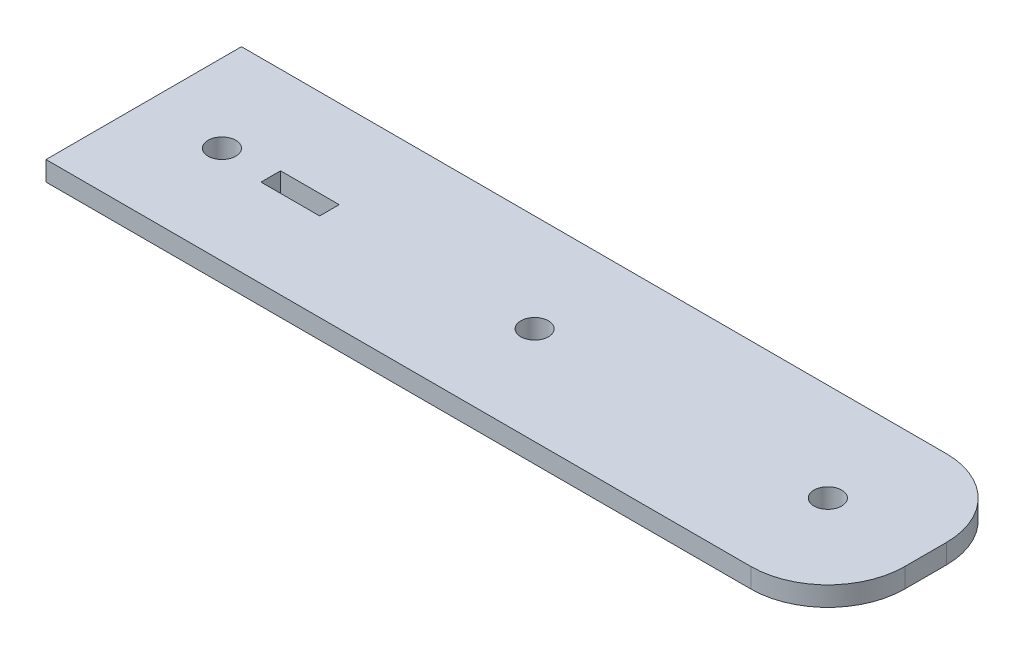
from build123d import *

# Parameters (mm, degrees)
SKETCH1_R           = 2.25
SKETCH1_W           = 9.525
SKETCH1_H           = 3.175
BOSS_EXTRUDE1_DEPTH = 3.175


with BuildPart() as part:
    # Sketch1 → Boss-Extrude1 (new body)
    with BuildSketch(Plane(origin=(0, 0, 0), x_dir=(1, 0, 0), z_dir=(0, 1, 0))):
        with BuildLine():
            Line((-12.7, -15.875), (101.8, -15.875))
            ThreePointArc((101.8, -15.875), (110.638834765, -12.213834765), (114.3, -3.375))
            Line((114.3, -3.375), (114.3, 3.375))
            ThreePointArc((114.3, 3.375), (110.638834765, 12.213834765), (101.8, 15.875))
            Line((101.8, 15.875), (-12.7, 15.875))
            Line((-12.7, 15.875), (-12.7, -15.875))
        make_face()
        Circle(SKETCH1_R, mode=Mode.SUBTRACT)
        with Locations((98.425, 0)):
            Circle(SKETCH1_R, mode=Mode.SUBTRACT)
        with Locations((50.8, 0)):
            Circle(SKETCH1_R, mode=Mode.SUBTRACT)
        with Locations((12.7, 0)):
            Rectangle(SKETCH1_W, SKETCH1_H, mode=Mode.SUBTRACT)
    extrude(amount=BOSS_EXTRUDE1_DEPTH)


solid = part.part
